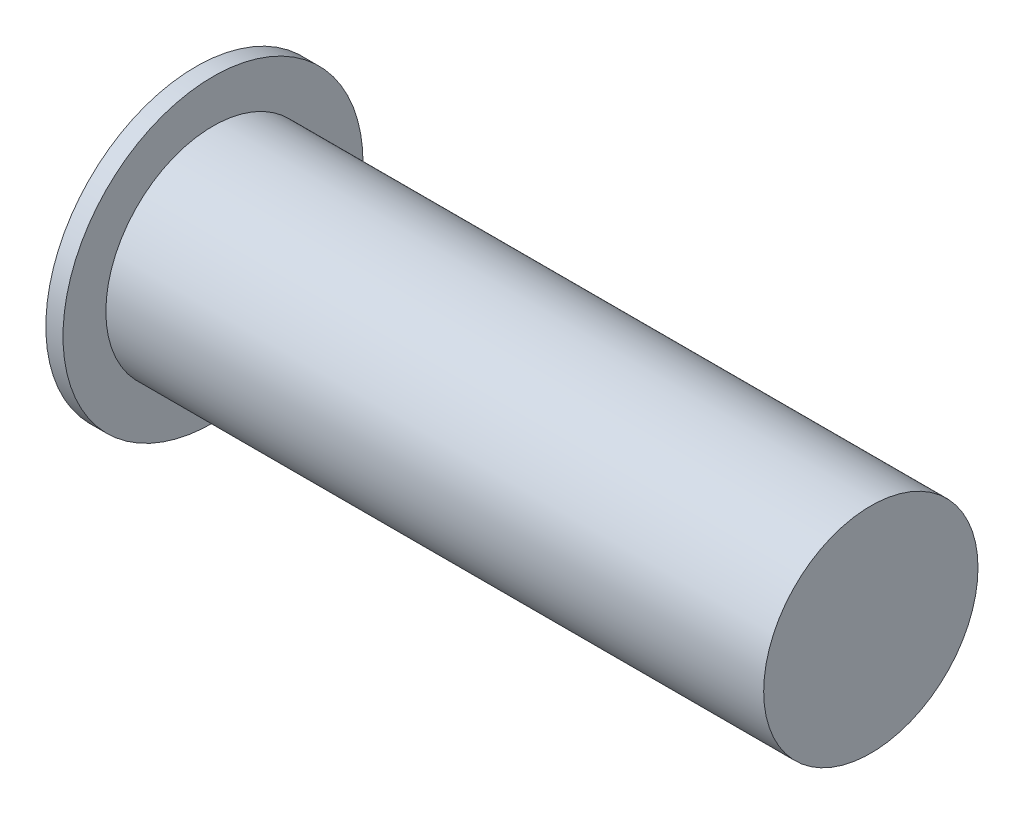
from build123d import *

# Parameters (mm, degrees)
SKETCH2_W          = 6.15375985
SKETCH2_H          = 0.730872065
CUT_EXTRUDE1_DEPTH = 0.254


with BuildPart() as part:
    # Sketch1 → Revolve1 (revolve)
    with BuildSketch(Plane(origin=(0, 0, 0), x_dir=(1, 0, 0), z_dir=(0, 1, 0))):
        Polygon((0, 0), (-19.490008539, 0), (-19.490008539, -1.27), (-19.998008539, -1.27), (-19.998008539, 3.175), (-19.490008539, 3.175), (0, 3.175), align=None)
    revolve(axis=Axis((0, 0, -3.175), (-1, 0, 0)))

    # Sketch2 → Cut-Extrude1 (cut)
    with BuildSketch(Plane.ZY.offset(19.998008539)):
        with Locations((-3.076879925, -0.012747769)):
            Rectangle(SKETCH2_W, SKETCH2_H)
    extrude(amount=-CUT_EXTRUDE1_DEPTH, mode=Mode.SUBTRACT)


solid = part.part
